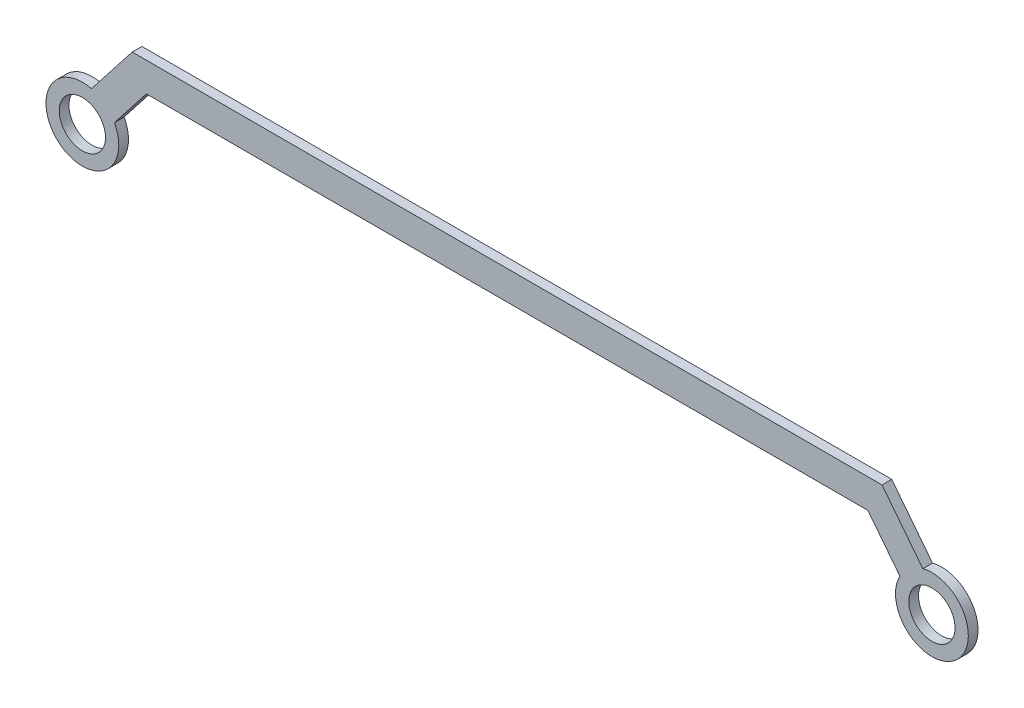
from build123d import *

# Parameters (mm, degrees)
SKETCH_1_R      = 9.53
EXTRUDE_1_DEPTH = 4


with BuildPart() as part:
    # 草图1 → 凸台-拉伸1 (new body)
    with BuildSketch(Plane.XY):
        with BuildLine():
            Line((20.535293155, 36), (329.464706845, 36))
            Line((329.464706845, 36), (346.257665152, 14.525664525))
            ThreePointArc((346.257665152, 14.525664525), (359.240172354, -11.816057501), (336.80481915, 7.133526642))
            Line((336.80481915, 7.133526642), (323.61521502, 24))
            Line((323.61521502, 24), (26.38478498, 24))
            Line((26.38478498, 24), (13.19518085, 7.133526642))
            ThreePointArc((13.19518085, 7.133526642), (-9.240172354, -11.816057501), (3.742334848, 14.525664525))
            Line((3.742334848, 14.525664525), (20.535293155, 36))
        make_face()
        Circle(SKETCH_1_R, mode=Mode.SUBTRACT)
        with Locations((350, 0)):
            Circle(SKETCH_1_R, mode=Mode.SUBTRACT)
    extrude(amount=EXTRUDE_1_DEPTH)


solid = part.part
